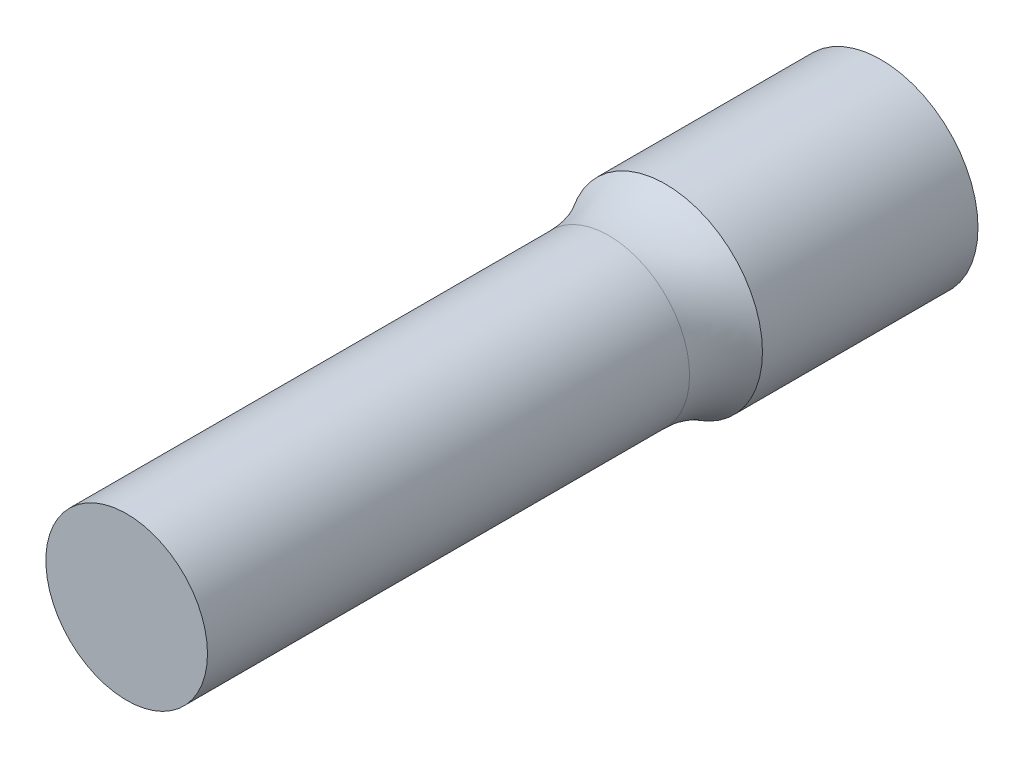
from build123d import *

# Parameters (mm, degrees)
SKETCH1_R           = 9
BOSS_EXTRUDE1_DEPTH = 70
SKETCH2_R           = 2.5
CUT_EXTRUDE1_DEPTH  = 15
CUT_EXTRUDE2_START  = -50
SKETCH3_R           = 9
SKETCH3_R_2         = 7.5
CUT_EXTRUDE2_DEPTH  = 50
FILLET1_R           = 10


with BuildPart() as part:
    # Sketch1 → Boss-Extrude1 (new body)
    with BuildSketch(Plane.XY):
        Circle(SKETCH1_R)
    extrude(amount=BOSS_EXTRUDE1_DEPTH)

    # Sketch2 → Cut-Extrude1 (cut)
    with BuildSketch(Plane(origin=(0, 0, 0), x_dir=(-1, 0, 0), z_dir=(0, 0, -1))):
        Circle(SKETCH2_R)
    extrude(amount=-CUT_EXTRUDE1_DEPTH, mode=Mode.SUBTRACT)

    # Sketch3 → Cut-Extrude2 (cut)
    with BuildSketch(Plane.XY.offset(70).offset(CUT_EXTRUDE2_START)):
        Circle(SKETCH3_R)
        Circle(SKETCH3_R_2, mode=Mode.SUBTRACT)
    extrude(amount=CUT_EXTRUDE2_DEPTH, mode=Mode.SUBTRACT)

    # Fillet1
    # the kernel refuses this fillet: 10 mm, written as the material it adds along each edge
    with BuildSketch(Plane(origin=(0, 0, 20), x_dir=(1, 0, 0), z_dir=(0, -1, 0))) as fillet1_piece_1:
        with BuildLine():
            CenterArc((17.5, 5.267826876), FILLET1_R, 180, 31.788330617)
            Line((7.5, 5.267826876), (7.3, 5.267826876))
            Line((7.3, 5.267826876), (7.3, 0))
            Line((7.3, 0), (7.5, -0.2))
            ThreePointArc((7.5, -0.2), (8.25, -0.2), (8.83, -0.105356538))
            Line((8.83, -0.105356538), (9, 0))
        make_face()
    revolve(axis=Axis((0, 0, 20), (0, 0, 1)))


solid = part.part
